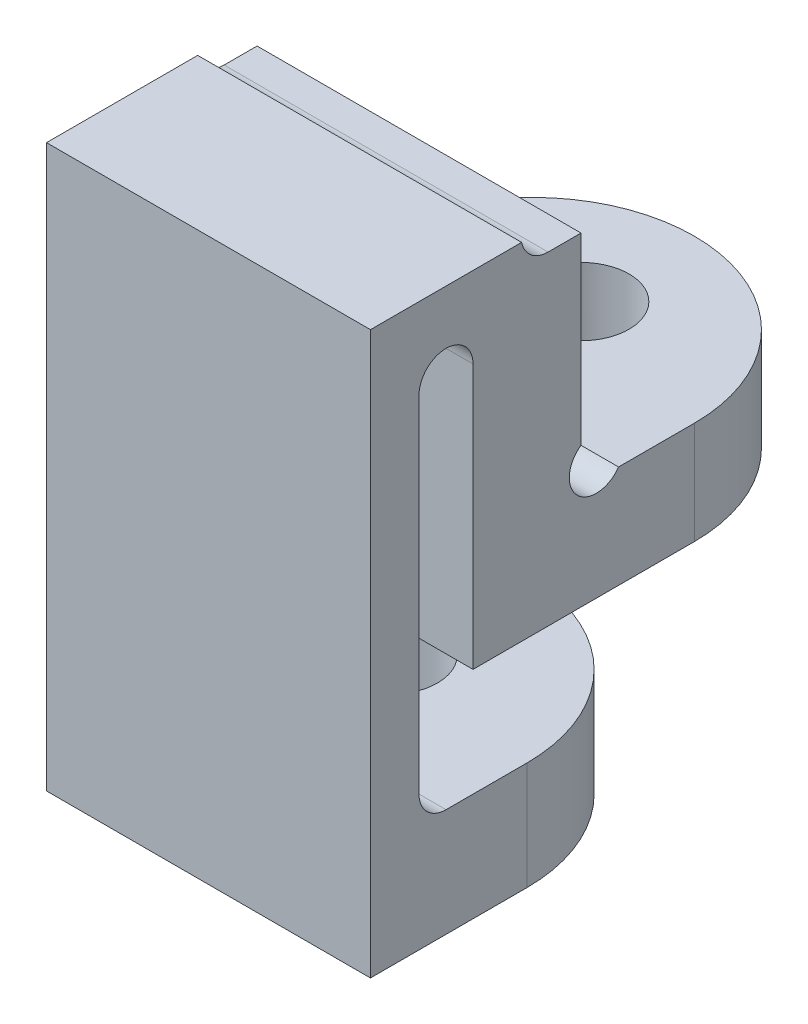
from build123d import *

# Parameters (mm, degrees)
BOSS_EXTRUDE1_DEPTH       = 6
SKETCH3_W                 = 7.6
SKETCH3_H                 = 16
CUT_EXTRUDE2_DEPTH        = 11.990294347
CUT_EXTRUDE3_DEPTH        = 11.990294347
FILLET2_R                 = 3
FILLET3_R                 = 0.5
F_2_56_TAPPED_HOLE1_D     = 1.778
F_2_56_TAPPED_HOLE1_DEPTH = 3
F_2_56_TAPPED_HOLE1_TIP   = 0.53416509
SKETCH13_R                = 0.5
CUT_EXTRUDE10_DEPTH       = 10


# Some blends are built 0.0001 mm under size
with BuildPart() as part:
    # Sketch1 → Boss-Extrude1 (new body)
    with BuildSketch(Plane(origin=(7.5, 0, 0), x_dir=(0, 0, -1), z_dir=(1, 0, 0))):
        with BuildLine():
            Line((-2, 0.497577099), (-2, 5.397577099))
            ThreePointArc((-2, 5.397577099), (-1.5, 5.897577099), (-1, 5.397577099))
            Line((-1, 5.397577099), (-1, 0.497577099))
            Line((-1, 0.497577099), (6.1, 0.497577099))
            Line((6.1, 0.497577099), (6.1, 6.897577099))
            Line((6.1, 6.897577099), (-2.9, 6.897577099))
            Line((-2.9, 6.897577099), (-2.9, -3.502422901))
            Line((-2.9, -3.502422901), (3, -3.502422901))
            Line((3, -3.502422901), (3, -1.502422901))
            Line((3, -1.502422901), (-2, -1.502422901))
            Line((-2, -1.502422901), (-2, 0.497577099))
        make_face()
    extrude(amount=-BOSS_EXTRUDE1_DEPTH)

    # Sketch3 → Cut-Extrude2 (cut, through all)
    with BuildSketch(Plane.ZY.offset(-1.5)):
        with Locations((6.8, 14.497577099)):
            Rectangle(SKETCH3_W, SKETCH3_H)
        with Locations((-3.7, 14.497577099)):
            Rectangle(SKETCH3_W, SKETCH3_H)
    extrude(amount=-CUT_EXTRUDE2_DEPTH, mode=Mode.SUBTRACT)

    # Sketch4 → Cut-Extrude3 (cut, through all)
    with BuildSketch(Plane.ZY.offset(-1.5)):
        Polygon((-1.707106781, 2.397577099), (-1, 2.397577099), (-1, 3.20468388), (-1, 6.497577099), (-7.5, 6.497577099), (-7.5, 2.397577099), align=None)
    extrude(amount=-CUT_EXTRUDE3_DEPTH, mode=Mode.SUBTRACT)

    # Fillet2
    fillet2_edges = [part.edges().sort_by_distance(p)[0] for p in [
        (7.5, 1.447577099, -6.1),
        (1.5, 1.447577099, -6.1),
        (7.5, -2.502422901, -3),
        (1.5, -2.502422901, -3),
    ]]
    fillet(fillet2_edges, radius=FILLET2_R - 0.0001)  # a hair under: the kernel refuses the full size

    # Fillet3
    # the kernel refuses this fillet: 0.5 mm, written as the material it adds along each edge
    with BuildSketch(Plane(origin=(1.5, 6.497577099, 0.1), x_dir=(0, 1.0, -1.570583940679385e-12), z_dir=(1, 0, 0))) as fillet3_piece_1:
        with BuildLine():
            CenterArc((0.5, -0.489897949), FILLET3_R, 101.536959033, 78.463040967)
            Line((0, -0.489897949), (-0.01, -0.489897949))
            Line((-0.01, -0.489897949), (-0.01, 0))
            Line((-0.01, 0), (0, 0.01))
            ThreePointArc((0, 0.01), (0.2, 0.01), (0.398, 0.009797959))
            Line((0.398, 0.009797959), (0.4, 0))
        make_face()
    extrude(amount=6)
    with BuildSketch(Plane(origin=(7.5, -1.502422901, 2), x_dir=(0, 0, -1), z_dir=(-1, 0, 0))) as fillet3_piece_2:
        with BuildLine():
            CenterArc((FILLET3_R, -FILLET3_R), FILLET3_R, 90, 90)
            Line((0, -FILLET3_R), (-FILLET3_R * 0.02, -FILLET3_R))
            Line((-FILLET3_R * 0.02, -FILLET3_R), (-FILLET3_R * 0.02, FILLET3_R * 0.02))
            Line((-FILLET3_R * 0.02, FILLET3_R * 0.02), (FILLET3_R, FILLET3_R * 0.02))
            Line((FILLET3_R, FILLET3_R * 0.02), (FILLET3_R, 0))
        make_face()
    extrude(amount=6)

    # #2-56 Tapped Hole1
    with Locations(Plane(origin=(0, 2.397577099, 0), x_dir=(1, 0, 0), z_dir=(0, 1, 0))):
        with Locations((4.5, 4)):
            Hole(F_2_56_TAPPED_HOLE1_D / 2, depth=F_2_56_TAPPED_HOLE1_DEPTH)
            with Locations((0, 0, -(F_2_56_TAPPED_HOLE1_DEPTH + F_2_56_TAPPED_HOLE1_TIP / 2))):  # 118° drill point
                Cone(0, F_2_56_TAPPED_HOLE1_D / 2, F_2_56_TAPPED_HOLE1_TIP, mode=Mode.SUBTRACT)

    # Sketch12 → #2-56 Tapped Hole2 (revolve, cut)
    with BuildSketch(Plane(origin=(4.5, -1.502422901, -0.45), x_dir=(0, 0, 1), z_dir=(1, 0, 0))):
        Polygon((0, 0), (0, 5.87416509), (0.889, 5.34), (0.889, 0), align=None)
    revolve(axis=Axis((4.5, 4.847577099, -0.45), (0, -1, 0)), mode=Mode.SUBTRACT)

    # Sketch13 → Cut-Extrude10 (cut)
    with BuildSketch(Plane.ZY.offset(-1.5)):
        with Locations((-1.282842712, 2.680419811)):
            Circle(SKETCH13_R)
    extrude(amount=-CUT_EXTRUDE10_DEPTH, mode=Mode.SUBTRACT)


solid = part.part
